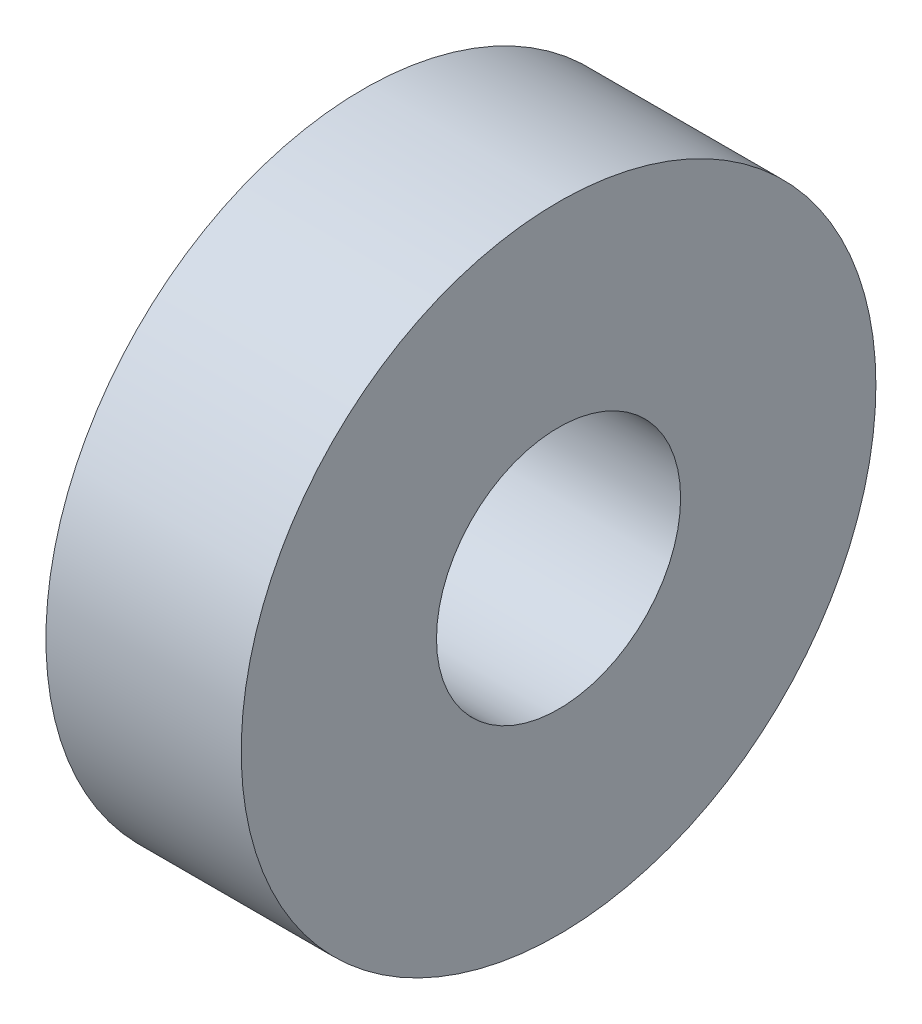
from build123d import *

# Parameters (mm, degrees)
SKETCH1_R           = 13
SKETCH1_R_2         = 5
BOSS_EXTRUDE1_DEPTH = 8


with BuildPart() as part:
    # Sketch1 → Boss-Extrude1 (new body)
    with BuildSketch(Plane(origin=(0, 0, 0), x_dir=(0, 0, -1), z_dir=(1, 0, 0))):
        Circle(SKETCH1_R)
        Circle(SKETCH1_R_2, mode=Mode.SUBTRACT)
    extrude(amount=BOSS_EXTRUDE1_DEPTH)


solid = part.part
